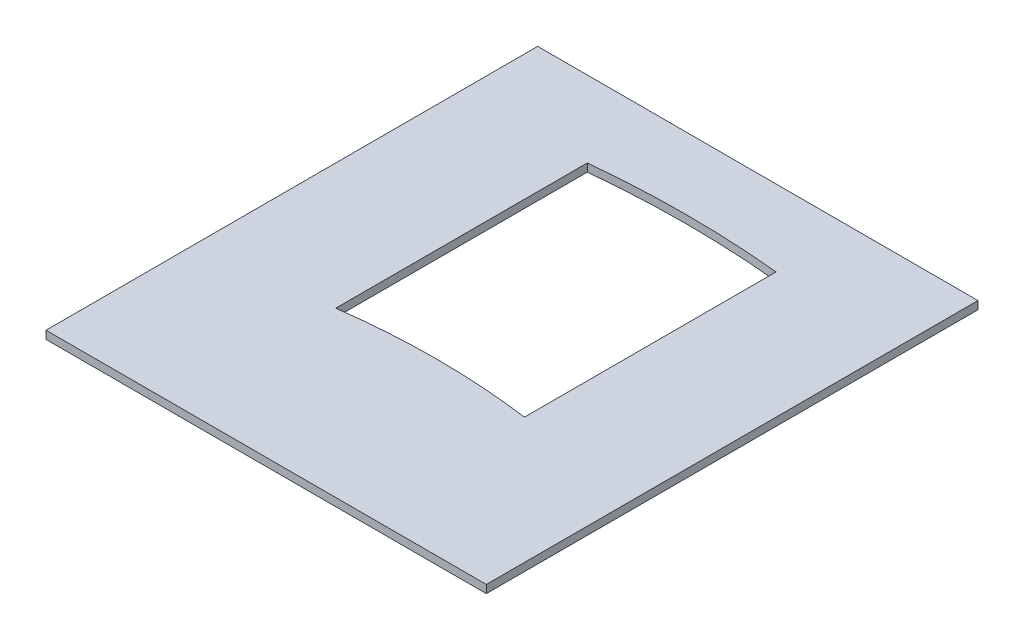
from build123d import *

# Parameters (mm, degrees)
SKETCH1_W           = 7
SKETCH1_H           = 7.816678586
BOSS_EXTRUDE1_DEPTH = 0.127


with BuildPart() as part:
    # Sketch1 → Boss-Extrude1 (new body)
    with BuildSketch(Plane(origin=(0, 0, 0), x_dir=(1, 0, 0), z_dir=(0, 1, 0))):
        with Locations((-0.1, 1.30265391)):
            Rectangle(SKETCH1_W, SKETCH1_H)
        with BuildLine():
            Line((-1.6, 0), (-1.6, 4))
            ThreePointArc((-1.6, 4), (-0.1, 4.075188443), (1.4, 4))
            Line((1.4, 4), (1.4, 0))
            ThreePointArc((1.4, 0), (-0.1, 0.102752641), (-1.6, 0))
        make_face(mode=Mode.SUBTRACT)
    extrude(amount=BOSS_EXTRUDE1_DEPTH)


solid = part.part
